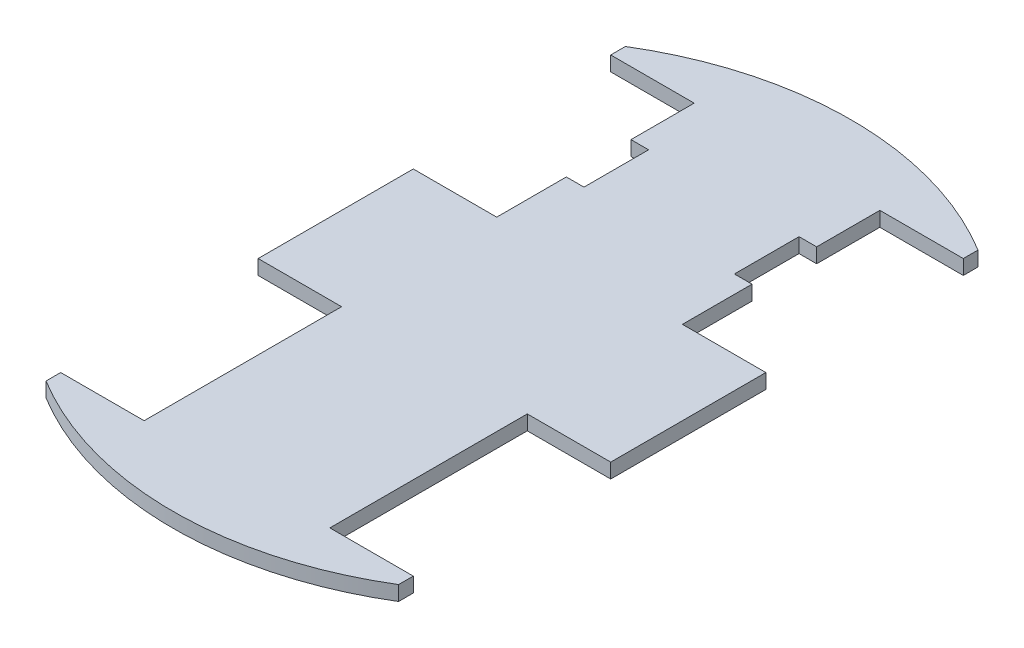
from build123d import *

# Parameters (mm, degrees)
CHASSIS_DEPTH = 6.35


with BuildPart() as part:
    # Sketch1 → Chassis (new body)
    with BuildSketch(Plane(origin=(0, 0, 0), x_dir=(1, 0, 0), z_dir=(0, 1, 0))):
        with BuildLine():
            Line((-40.132, -42.672), (-76.2, -42.672))
            Line((-76.2, -42.672), (-76.2, -109.728))
            Line((-76.2, -109.728), (-40.132, -109.728))
            Line((-40.132, -109.728), (-40.132, -195.072))
            Line((-40.132, -195.072), (-76.2, -195.072))
            Line((-76.2, -195.072), (-76.2, -201.422))
            ThreePointArc((-76.2, -201.422), (0, -222.784410099), (76.2, -201.422))
            Line((76.2, -201.422), (76.2, -195.072))
            Line((76.2, -195.072), (40.132, -195.072))
            Line((40.132, -195.072), (40.132, -109.728))
            Line((40.132, -109.728), (76.2, -109.728))
            Line((76.2, -109.728), (76.2, -42.672))
            Line((76.2, -42.672), (40.132, -42.672))
            Line((40.132, -42.672), (40.132, -12.586521862))
            Line((40.132, -12.586521862), (32.512, -12.586521862))
            Line((32.512, -12.586521862), (32.512, 15.353478138))
            Line((32.512, 15.353478138), (40.132, 15.353478138))
            Line((40.132, 15.353478138), (40.132, 42.672))
            Line((40.132, 42.672), (76.2, 42.672))
            Line((76.2, 42.672), (76.2, 49.022))
            ThreePointArc((76.2, 49.022), (0, 70.384410099), (-76.2, 49.022))
            Line((-76.2, 49.022), (-76.2, 42.672))
            Line((-76.2, 42.672), (-40.132, 42.672))
            Line((-40.132, 42.672), (-40.132, 15.353478138))
            Line((-40.132, 15.353478138), (-32.512, 15.353478138))
            Line((-32.512, 15.353478138), (-32.512, -12.586521862))
            Line((-32.512, -12.586521862), (-40.132, -12.586521862))
            Line((-40.132, -12.586521862), (-40.132, -42.672))
        make_face()
    extrude(amount=CHASSIS_DEPTH)


solid = part.part
